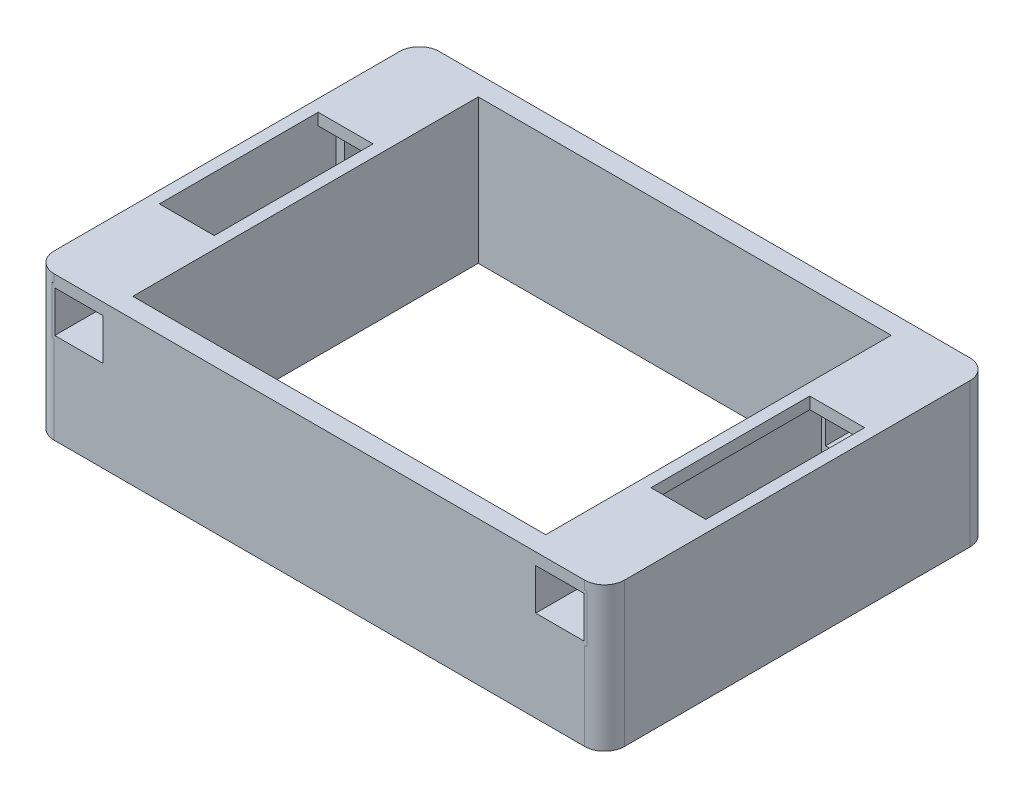
from build123d import *
from build123d.topology import SkipClean

# Parameters (mm, degrees)
CROQUIS1_W              = 114
CROQUIS1_H              = 34.2
SALIENTE_EXTRUIR1_DEPTH = 97
VACIADO1_T              = -5
SALIENTE_EXTRUIR2_DEPTH = 97
CORTAR_EXTRUIR1_REACH   = 128.031
CROQUIS3_W              = 13.814275766
CROQUIS3_H              = 40
REDONDEO2_R             = 5
CROQUIS6_W              = 12.3
CROQUIS6_H              = 10.4
CORTAR_EXTRUIR3_DEPTH   = 124.459670354
SALIENTE_EXTRUIR3_DEPTH = 97
CROQUIS8_W              = 13.814275766
CROQUIS8_H              = 40
CORTAR_EXTRUIR4_DEPTH   = 127.030661617
CROQUIS9_W              = 104
CROQUIS9_H              = 87
CORTAR_EXTRUIR5_DEPTH   = 10
CORTAR_EXTRUIR6_START   = -33.316303
CROQUIS11_W             = 1.5
CROQUIS11_H             = 39.999512223
CROQUIS11_H_2           = 40
CORTAR_EXTRUIR6_DEPTH   = 33.316303
CORTAR_EXTRUIR7_START   = -33.316303
CROQUIS13_W             = 15.314275766
CROQUIS13_H             = 4.5
CORTAR_EXTRUIR7_DEPTH   = 33.316303


with BuildPart() as part:
    # Croquis1 → Saliente-Extruir1 (new body)
    with BuildSketch(Plane.XY):
        with Locations((0, -8.9)):
            Rectangle(CROQUIS1_W, CROQUIS1_H)
    extrude(amount=-SALIENTE_EXTRUIR1_DEPTH)

    # Vaciado1
    vaciado1_openings = [part.faces().sort_by_distance(p)[0] for p in [
        (0, -26, -48.5),
    ]]
    offset(amount=VACIADO1_T, openings=vaciado1_openings, kind=Kind.INTERSECTION)

    # Croquis2 → Saliente-Extruir2 (add, through all)
    with BuildSketch(Plane(origin=(0, 0, -97), x_dir=(-1, 0, 0), z_dir=(0, 0, -1))):
        Polygon((71.814275766, 8.2), (67.33466189, 8.2), (67.33466189, -3.967393508), (57, -3.967393508), (57, -26), (67.33466189, -26), (71.814275766, -26), align=None)
        Polygon((-57, 8.2), (57, 8.2), (67.33466189, 8.2), (71.814275766, 8.2), (71.814275766, 10.296521374), (-71.814275766, 10.296521374), (-71.814275766, 8.2), (-67.33466189, 8.2), align=None)
        Polygon((-67.33466189, -3.967393508), (-67.33466189, 8.2), (-71.814275766, 8.2), (-71.814275766, -26), (-67.33466189, -26), (-57, -26), (-57, -3.967393508), align=None)
    extrude(amount=-SALIENTE_EXTRUIR2_DEPTH)

    # Croquis3 → Cortar-Extruir1 (cut, up to next)
    with BuildSketch(Plane.XZ.offset(26), mode=Mode.PRIVATE) as cortar_extruir1_sk1:
        with Locations((-61.907137883, -48.5)):
            Rectangle(CROQUIS3_W, CROQUIS3_H)
    cortar_extruir1_tool1 = extrude(cortar_extruir1_sk1.sketch, amount=-CORTAR_EXTRUIR1_REACH, mode=Mode.PRIVATE) & part.part
    # Croquis3 → Cortar-Extruir1 (cut, up to next)
    with BuildSketch(Plane.XZ.offset(26), mode=Mode.PRIVATE) as cortar_extruir1_sk2:
        with Locations((61.907137883, -48.5)):
            Rectangle(CROQUIS3_W, CROQUIS3_H)
    cortar_extruir1_tool2 = extrude(cortar_extruir1_sk2.sketch, amount=-CORTAR_EXTRUIR1_REACH, mode=Mode.PRIVATE) & part.part
    add(cortar_extruir1_tool1.solids().sort_by_distance((-61.907138, -26, -48.5))[0], mode=Mode.SUBTRACT)
    add(cortar_extruir1_tool2.solids().sort_by_distance((61.907138, -26, -48.5))[0], mode=Mode.SUBTRACT)

    # Redondeo2
    # the kernel refuses this fillet: 5 mm, written as the material it takes off along each edge
    with BuildSketch(Plane(origin=(71.814275766, -38.5, -97), x_dir=(0, 0, 1), z_dir=(0, 1, 0)), Plane(origin=(71.814275766, -38.5, 0), x_dir=(-1, 0, 0), z_dir=(0, 1, 0)), Plane(origin=(-71.814275766, 22.796521374, -97), x_dir=(0, 0, 1), z_dir=(0, -1, 0)), Plane(origin=(-71.814275766, 22.796521374, 0), x_dir=(1, 0, 0), z_dir=(0, -1, 0))) as redondeo2_piece_1:
        with BuildLine():
            CenterArc((REDONDEO2_R, -REDONDEO2_R), REDONDEO2_R, 90, 90)
            Line((0, -REDONDEO2_R), (0, 0))
            Line((0, 0), (REDONDEO2_R, 0))
        make_face()
    extrude(amount=61.296521374, mode=Mode.SUBTRACT)

    # Croquis6 → Cortar-Extruir3 (cut, through all)
    with BuildSketch(Plane(origin=(0, 0, -97), x_dir=(-1, 0, 0), z_dir=(0, 0, -1))):
        with Locations((-60.617330945, 2.116303246)):
            Rectangle(CROQUIS6_W, CROQUIS6_H)
        with Locations((60.617330945, 2.116303246)):
            Rectangle(CROQUIS6_W, CROQUIS6_H)
    extrude(amount=-CORTAR_EXTRUIR3_DEPTH, mode=Mode.SUBTRACT)

    # Croquis7 → Saliente-Extruir3 (add, through all)
    with BuildSketch(Plane(origin=(0, 0, -97), x_dir=(-1, 0, 0), z_dir=(0, 0, -1))):
        Polygon((57, 8.2), (57, 7.316303246), (66.667330945, 7.316303246), (66.667330945, -3.083696754), (57, -3.083696754), (57, -3.967393508), (66.814275766, -3.967393508), (67.33466189, -3.967393508), (67.33466189, 8.2), (66.814275766, 8.2), align=None)
        Polygon((-66.667330945, 7.32503221), (-57, 7.32503221), (-57, 8.2), (-66.814275766, 8.2), (-67.33466189, 8.2), (-67.33466189, -3.967393508), (-66.814275766, -3.967393508), (-57, -3.967393508), (-57, -3.083696754), (-66.667330945, -3.083696754), align=None)
    extrude(amount=-SALIENTE_EXTRUIR3_DEPTH)

    # Croquis8 → Cortar-Extruir4 (cut, through all)
    with BuildSketch(Plane(origin=(0, 10.296521374, 0), x_dir=(1, 0, 0), z_dir=(0, 1, 0))):
        with Locations((-61.907137883, 48.5)):
            Rectangle(CROQUIS8_W, CROQUIS8_H)
        with Locations((61.907137883, 48.5)):
            Rectangle(CROQUIS8_W, CROQUIS8_H)
    extrude(amount=-CORTAR_EXTRUIR4_DEPTH, mode=Mode.SUBTRACT)

    # Croquis9 → Cortar-Extruir5 (cut)
    with BuildSketch(Plane.XZ.offset(-3.2)):
        with Locations((0, -48.5)):
            Rectangle(CROQUIS9_W, CROQUIS9_H)
    extrude(amount=-CORTAR_EXTRUIR5_DEPTH, mode=Mode.SUBTRACT)

    # Croquis11 → Cortar-Extruir6 (cut)
    with SkipClean():  # the faces are left unmerged after this step: merging them gives an invalid solid
        with BuildSketch(Plane.XZ.offset(26).offset(CORTAR_EXTRUIR6_START)):
            with Locations((54.25, -48.499756112)):
                Rectangle(CROQUIS11_W, CROQUIS11_H)
            with Locations((-54.25, -48.5)):
                Rectangle(CROQUIS11_W, CROQUIS11_H_2)
        extrude(amount=CORTAR_EXTRUIR6_DEPTH, mode=Mode.SUBTRACT)

    # Croquis13 → Cortar-Extruir7 (cut)
    with BuildSketch(Plane.XZ.offset(26).offset(CORTAR_EXTRUIR7_START)):
        with Locations((-61.157137883, -26.25)):
            Rectangle(CROQUIS13_W, CROQUIS13_H)
        with Locations((-61.157137883, -70.75)):
            Rectangle(CROQUIS13_W, CROQUIS13_H)
        with Locations((61.157137883, -26.25)):
            Rectangle(CROQUIS13_W, CROQUIS13_H)
        with Locations((61.157137883, -70.749512223)):
            Rectangle(CROQUIS13_W, CROQUIS13_H)
    extrude(amount=CORTAR_EXTRUIR7_DEPTH, mode=Mode.SUBTRACT)


solid = part.part
